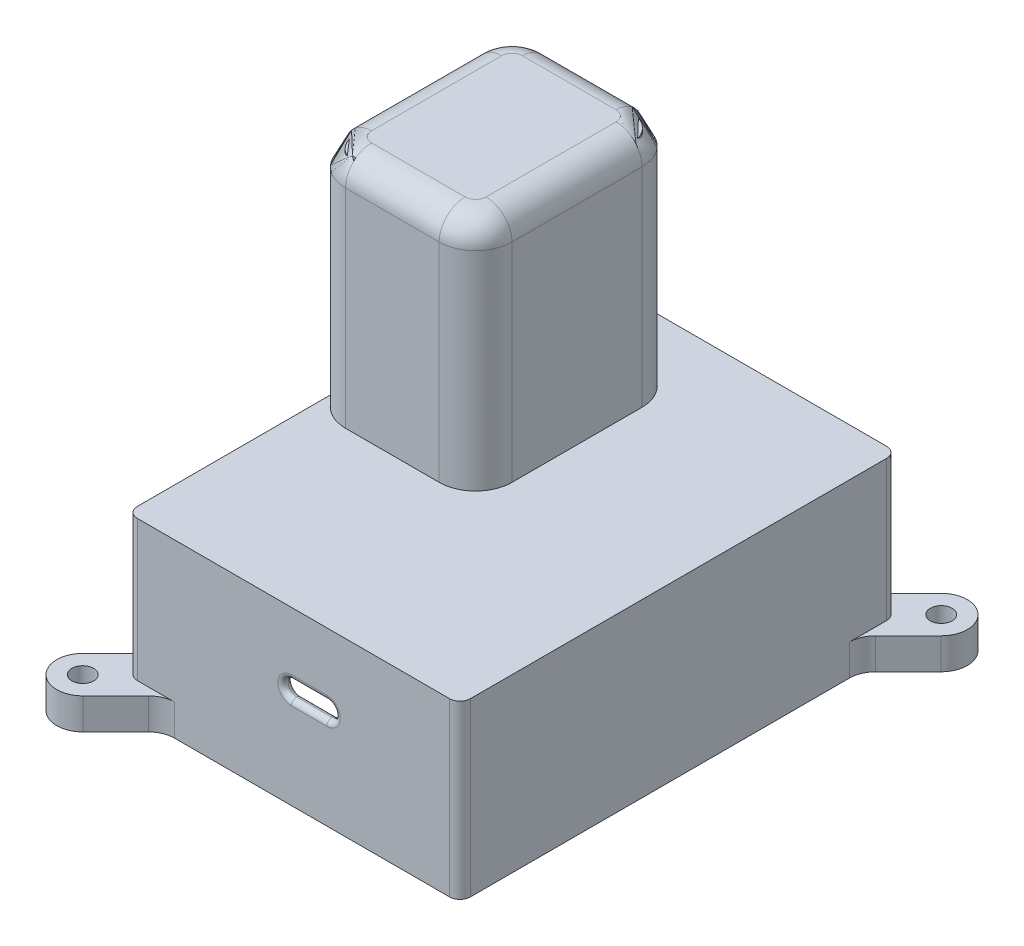
from build123d import *

# Parameters (mm, degrees)
SKETCH1_W                = 64
SKETCH1_H                = 84
SKETCH1_W_2              = 60
SKETCH1_H_2              = 80
BOSS_EXTRUDE1_DEPTH      = 30
SKETCH2_R                = 2.1
BOSS_EXTRUDE2_DEPTH      = 6
CUT_EXTRUDE1_DEPTH       = 30
FILLET2_R                = 1
FILLET7_R                = 2
FILLET8_R                = 1.1
FILLET9_R                = 5
BOSS_EXTRUDE3_START      = 3
SKETCH5_W                = 2
SKETCH5_H                = 35
BOSS_EXTRUDE3_DEPTH      = 3
BOSS_EXTRUDE4_DEPTH      = 45
BOSS_EXTRUDE4_DEPTH_BACK = 3
BOSS_EXTRUDE6_DEPTH      = 2
FILLET11_R               = 5
FILLET12_R               = 2


with BuildPart() as part:
    # Sketch1 → Boss-Extrude1 (new body)
    with BuildSketch(Plane(origin=(0, 0, 0), x_dir=(1, 0, 0), z_dir=(0, 1, 0))):
        with Locations((30, -40)):
            Rectangle(SKETCH1_W, SKETCH1_H)
        with Locations((30, -40)):
            Rectangle(SKETCH1_W_2, SKETCH1_H_2, mode=Mode.SUBTRACT)
    extrude(amount=BOSS_EXTRUDE1_DEPTH)

    # Sketch2 → Boss-Extrude2 (add)
    # profile 1 of 8: a face of its own
    with BuildSketch(Plane(origin=(0, 0, 0), x_dir=(1, 0, 0), z_dir=(0, 1, 0))):
        with BuildLine():
            ThreePointArc((-9.778174593, -82.707106781), (-9.778174593, -89.778174593), (-2.707106781, -89.778174593))
            Line((-2.707106781, -89.778174593), (-2.707106781, -82.707106781))
            Line((-2.707106781, -82.707106781), (-9.778174593, -82.707106781))
        make_face()
        with Locations(Location((-6.242640687, -86.242640687, 0), (0, 0, 270))):
            Circle(SKETCH2_R, mode=Mode.SUBTRACT)
    # profile 2 of 8: a face of its own
    with BuildSketch(Plane(origin=(0, 0, 0), x_dir=(1, 0, 0), z_dir=(0, 1, 0))):
        with BuildLine():
            ThreePointArc((-1.242640687, -86.242640687), (-1.623243025, -88.156057849), (-2.707106781, -89.778174593))
            Line((-2.707106781, -89.778174593), (5.071067812, -82))
            Line((5.071067812, -82), (0, -80))
            Line((0, -80), (-2, -74.928932188))
            Line((-2, -74.928932188), (-9.778174593, -82.707106781))
            ThreePointArc((-9.778174593, -82.707106781), (-6.242640687, -81.242640687), (-2.707106781, -82.707106781))
            ThreePointArc((-2.707106781, -82.707106781), (-1.623243025, -84.329223525), (-1.242640687, -86.242640687))
        make_face()
    # profile 3 of 8: a face of its own
    with BuildSketch(Plane(origin=(0, 0, 0), x_dir=(1, 0, 0), z_dir=(0, 1, 0))):
        with BuildLine():
            Line((-2.707106781, -82.707106781), (-2.707106781, -89.778174593))
            ThreePointArc((-2.707106781, -89.778174593), (-1.623243025, -88.156057849), (-1.242640687, -86.242640687))
            ThreePointArc((-1.242640687, -86.242640687), (-1.623243025, -84.329223525), (-2.707106781, -82.707106781))
        make_face()
    # profile 4 of 8: a face of its own
    with BuildSketch(Plane(origin=(0, 0, 0), x_dir=(1, 0, 0), z_dir=(0, 1, 0))):
        with BuildLine():
            Line((-9.778174593, -82.707106781), (-2.707106781, -82.707106781))
            ThreePointArc((-2.707106781, -82.707106781), (-6.242640687, -81.242640687), (-9.778174593, -82.707106781))
        make_face()
    # profile 5 of 8: a face of its own
    with BuildSketch(Plane(origin=(0, 0, 0), x_dir=(1, 0, 0), z_dir=(0, 1, 0))):
        with BuildLine():
            Line((62, -5.071067812), (69.778174593, 2.707106781))
            ThreePointArc((69.778174593, 2.707106781), (66.242640687, 1.242640687), (62.707106781, 2.707106781))
            ThreePointArc((62.707106781, 2.707106781), (61.243738197, 6.137884352), (62.562095354, 9.626955397))
            Line((62.562095354, 9.626955397), (54.928932188, 2))
            Line((54.928932188, 2), (60, 0))
            Line((60, 0), (62, -5.071067812))
        make_face()
    # profile 6 of 8: a face of its own
    with BuildSketch(Plane(origin=(0, 0, 0), x_dir=(1, 0, 0), z_dir=(0, 1, 0))):
        with BuildLine():
            ThreePointArc((62.707106781, 2.707106781), (66.242640687, 1.242640687), (69.778174593, 2.707106781))
            Line((69.778174593, 2.707106781), (62.707106781, 2.707106781))
        make_face()
    # profile 7 of 8: a face of its own
    with BuildSketch(Plane(origin=(0, 0, 0), x_dir=(1, 0, 0), z_dir=(0, 1, 0))):
        with BuildLine():
            ThreePointArc((62.562095354, 9.626955397), (61.243738197, 6.137884352), (62.707106781, 2.707106781))
            Line((62.707106781, 2.707106781), (62.861321566, 9.925938259))
            Line((62.861321566, 9.925938259), (62.562095354, 9.626955397))
        make_face()
    # profile 8 of 8: a face of its own
    with BuildSketch(Plane(origin=(0, 0, 0), x_dir=(1, 0, 0), z_dir=(0, 1, 0))):
        with BuildLine():
            Line((62.707106781, 2.707106781), (69.778174593, 2.707106781))
            ThreePointArc((69.778174593, 2.707106781), (70.86203835, 4.329223525), (71.242640687, 6.242640687))
            ThreePointArc((71.242640687, 6.242640687), (68.254282354, 10.820117918), (62.861321566, 9.925938259))
            Line((62.861321566, 9.925938259), (62.707106781, 2.707106781))
        make_face()
        with Locations(Location((66.242640687, 6.242640687, 0), (0, 0, 270))):
            Circle(SKETCH2_R, mode=Mode.SUBTRACT)
    extrude(amount=BOSS_EXTRUDE2_DEPTH)

    # Sketch4 → Cut-Extrude1 (cut)
    with BuildSketch(Plane.XY.offset(82)):
        with BuildLine():
            Line((33.001314869, 20.8), (29.601314869, 20.8))
            ThreePointArc((29.601314869, 20.8), (28.001314869, 19.2), (29.601314869, 17.6))
            Line((29.601314869, 17.6), (33.001314869, 17.6))
            Line((33.001314869, 17.6), (36.401314869, 17.6))
            ThreePointArc((36.401314869, 17.6), (38.001314869, 19.2), (36.401314869, 20.8))
            Line((36.401314869, 20.8), (33.001314869, 20.8))
        make_face()
    extrude(amount=-CUT_EXTRUDE1_DEPTH, mode=Mode.SUBTRACT)

    # Fillet2
    fillet2_edges = [part.edges().sort_by_distance(p)[0] for p in [
        (33.001314869, 17.6, 82),
        (38.001314869, 19.2, 82),
        (33.001314869, 20.8, 82),
        (28.001314869, 19.2, 82),
    ]]
    fillet(fillet2_edges, radius=FILLET2_R)

    # Fillet7
    fillet7_edges = [part.edges().sort_by_distance(p)[0] for p in [
        (0, 15, 0),
        (0, 15, 80),
        (60, 15, 80),
        (60, 15, 0),
        (-2, 18, 82),
        (-2, 15, -2),
        (62, 18, -2),
        (62, 15, 82),
    ]]
    fillet(fillet7_edges, radius=FILLET7_R)

    # Fillet8
    # the kernel refuses this fillet: 1.1 mm, written as the material it takes off along each edge
    with BuildSketch(Plane(origin=(36.401314869, 19.2, 80), x_dir=(0, -1, 0), z_dir=(-1, 0, 0))) as fillet8_piece_1:
        with BuildLine():
            CenterArc((2.695445115, 1.1), FILLET8_R, 185.21590857, 84.78409143)
            Line((1.6, 1), (1.6, 0))
            Line((1.6, 0), (2.695445115, 0))
        make_face()
    revolve(axis=Axis((36.401314869, 19.2, 80), (0, 0, 1)), revolution_arc=180, mode=Mode.SUBTRACT)
    with BuildSketch(Plane(origin=(36.401314869, 20.8, 80), x_dir=(0, 1, 0), z_dir=(-1, 0, 0)), Plane(origin=(29.601314869, 17.6, 80), x_dir=(0, -1, 0), z_dir=(1, 0, 0))) as fillet8_piece_2:
        with BuildLine():
            CenterArc((1.095445115, -1.1), FILLET8_R, 90, 84.78409143)
            Line((0, -1), (0, 0))
            Line((0, 0), (1.095445115, 0))
        make_face()
    extrude(amount=6.8, mode=Mode.SUBTRACT)
    with BuildSketch(Plane(origin=(29.601314869, 19.2, 80), x_dir=(0, 1, 0), z_dir=(1, 0, 0))) as fillet8_piece_3:
        with BuildLine():
            CenterArc((2.695445115, 1.1), FILLET8_R, 185.21590857, 84.78409143)
            Line((1.6, 1), (1.6, 0))
            Line((1.6, 0), (2.695445115, 0))
        make_face()
    revolve(axis=Axis((29.601314869, 19.2, 80), (0, 0, 1)), revolution_arc=180, mode=Mode.SUBTRACT)

    # Fillet9
    fillet9_edges = [part.edges().sort_by_distance(p)[0] for p in [
        (-2, 3, 74.928932188),
        (5.071067812, 3, 82),
        (62, 3, 5.071067812),
        (54.928932188, 3, -2),
    ]]
    fillet(fillet9_edges, radius=FILLET9_R)

    # Sketch5 → Boss-Extrude3 (add)
    with BuildSketch(Plane(origin=(0, 30, 0), x_dir=(1, 0, 0), z_dir=(0, 1, 0)).offset(BOSS_EXTRUDE3_START)):
        with Locations((-1, -27.5)):
            Rectangle(SKETCH5_W, SKETCH5_H)
        with BuildLine():
            Line((28, -45), (0, -45))
            Line((0, -45), (0, -78))
            ThreePointArc((0, -78), (0.585786438, -79.414213562), (2, -80))
            Line((2, -80), (58, -80))
            ThreePointArc((58, -80), (59.414213562, -79.414213562), (60, -78))
            Line((60, -78), (60, -2))
            ThreePointArc((60, -2), (59.414213562, -0.585786438), (58, 0))
            Line((58, 0), (2, 0))
            ThreePointArc((2, 0), (0.585786438, -0.585786438), (0, -2))
            Line((0, -2), (0, -10))
            Line((0, -10), (28, -10))
            Line((28, -10), (28, -45))
        make_face()
        with BuildLine():
            Line((0, -45), (-2, -45))
            Line((-2, -45), (-2, -80))
            ThreePointArc((-2, -80), (-1.414213562, -81.414213562), (0, -82))
            Line((0, -82), (60, -82))
            ThreePointArc((60, -82), (61.414213562, -81.414213562), (62, -80))
            Line((62, -80), (62, 0))
            ThreePointArc((62, 0), (61.414213562, 1.414213562), (60, 2))
            Line((60, 2), (0, 2))
            ThreePointArc((0, 2), (-1.414213562, 1.414213562), (-2, 0))
            Line((-2, 0), (-2, -10))
            Line((-2, -10), (0, -10))
            Line((0, -10), (0, -2))
            ThreePointArc((0, -2), (0.585786438, -0.585786438), (2, 0))
            Line((2, 0), (58, 0))
            ThreePointArc((58, 0), (59.414213562, -0.585786438), (60, -2))
            Line((60, -2), (60, -78))
            ThreePointArc((60, -78), (59.414213562, -79.414213562), (58, -80))
            Line((58, -80), (2, -80))
            ThreePointArc((2, -80), (0.585786438, -79.414213562), (0, -78))
            Line((0, -78), (0, -45))
        make_face()
    extrude(amount=-BOSS_EXTRUDE3_DEPTH)

    # Sketch6 → Boss-Extrude4 (add, two sides: drawn at the far end of the back side and taken through both)
    with BuildSketch(Plane(origin=(0, 33, 0), x_dir=(1, 0, 0), z_dir=(0, 1, 0)).offset(-BOSS_EXTRUDE4_DEPTH_BACK)):
        with BuildLine():
            Line((-2, -40), (-2, -15))
            ThreePointArc((-2, -15), (0.050252532, -10.050252532), (5, -8))
            Line((5, -8), (14, -8))
            Line((14, -8), (23, -8))
            ThreePointArc((23, -8), (27.949747468, -10.050252532), (30, -15))
            Line((30, -15), (30, -40))
            ThreePointArc((30, -40), (27.949747468, -44.949747468), (23, -47))
            Line((23, -47), (14, -47))
            Line((14, -47), (5, -47))
            ThreePointArc((5, -47), (0.050252532, -44.949747468), (-2, -40))
        make_face()
        with BuildLine():
            Line((5, -10), (14, -10))
            Line((14, -10), (23, -10))
            ThreePointArc((23, -10), (26.535533906, -11.464466094), (28, -15))
            Line((28, -15), (28, -40))
            ThreePointArc((28, -40), (26.535533906, -43.535533906), (23, -45))
            Line((23, -45), (14, -45))
            Line((14, -45), (5, -45))
            ThreePointArc((5, -45), (1.464466094, -43.535533906), (0, -40))
            Line((0, -40), (0, -15))
            ThreePointArc((0, -15), (1.464466094, -11.464466094), (5, -10))
        make_face(mode=Mode.SUBTRACT)
    extrude(amount=BOSS_EXTRUDE4_DEPTH + BOSS_EXTRUDE4_DEPTH_BACK)

    # Sketch7 → Boss-Extrude6 (add)
    with BuildSketch(Plane(origin=(0, 78, 0), x_dir=(1, 0, 0), z_dir=(0, 1, 0))):
        Polygon((0, -15), (0, -40), (0.050252532, -44.949747468), (4.292893219, -44.949747468), (5, -45), (23, -45), (25.012302519, -45), (26.626096331, -43.896174296), (28, -42.956432073), (28, -40), (28, -15), (27.949747468, -10.050252532), (23, -10), (5, -10), (3.904127918, -9.641868727), (2.415865255, -9.84051764), (1.161892949, -10.698227499), (0.397822666, -11.748824139), (-0.232535318, -13.257862949), align=None)
    extrude(amount=-BOSS_EXTRUDE6_DEPTH)

    # Fillet11
    # the kernel refuses this fillet: 5 mm, written as the material it takes off along each edge
    with BuildSketch(Plane(origin=(5, 78, 40), x_dir=(-0.7071067811865479, 0, 0.7071067811865472), z_dir=(0.7071067811865472, 0, 0.7071067811865479))) as fillet11_piece_1:
        with BuildLine():
            CenterArc((7 - FILLET11_R, FILLET11_R), FILLET11_R, 270, 90)
            Line((7 - FILLET11_R, 0), (7, 0))
            Line((7, 0), (7, FILLET11_R))
        make_face()
    revolve(axis=Axis((5, 78, 40), (0, -1, 0)), revolution_arc=45, mode=Mode.SUBTRACT)
    with BuildSketch(Plane(origin=(23, 78, 47), x_dir=(0, -1, 0), z_dir=(-1, 0, 0)), Plane(origin=(5, 78, 8), x_dir=(0, -1, 0), z_dir=(1, 0, 0))) as fillet11_piece_2:
        with BuildLine():
            CenterArc((FILLET11_R, -FILLET11_R), FILLET11_R, 90, 90)
            Line((0, -FILLET11_R), (0, 0))
            Line((0, 0), (FILLET11_R, 0))
        make_face()
    extrude(amount=18, mode=Mode.SUBTRACT)
    with BuildSketch(Plane(origin=(23, 78, 40), x_dir=(1, 0, 0), z_dir=(0, 0, -1))) as fillet11_piece_3:
        with BuildLine():
            CenterArc((7 - FILLET11_R, FILLET11_R), FILLET11_R, 270, 90)
            Line((7 - FILLET11_R, 0), (7, 0))
            Line((7, 0), (7, FILLET11_R))
        make_face()
    revolve(axis=Axis((23, 78, 40), (0, -1, 0)), revolution_arc=90, mode=Mode.SUBTRACT)
    with BuildSketch(Plane(origin=(30, 78, 15), x_dir=(0, -1, 0), z_dir=(0, 0, 1)), Plane(origin=(-2, 78, 40), x_dir=(0, -1, 0), z_dir=(0, 0, -1))) as fillet11_piece_4:
        with BuildLine():
            CenterArc((FILLET11_R, -FILLET11_R), FILLET11_R, 90, 90)
            Line((0, -FILLET11_R), (0, 0))
            Line((0, 0), (FILLET11_R, 0))
        make_face()
    extrude(amount=25, mode=Mode.SUBTRACT)
    with BuildSketch(Plane(origin=(23, 78, 15), x_dir=(0, 0, -1), z_dir=(-1, 0, 0))) as fillet11_piece_5:
        with BuildLine():
            CenterArc((7 - FILLET11_R, FILLET11_R), FILLET11_R, 270, 90)
            Line((7 - FILLET11_R, 0), (7, 0))
            Line((7, 0), (7, FILLET11_R))
        make_face()
    revolve(axis=Axis((23, 78, 15), (0, -1, 0)), revolution_arc=45, mode=Mode.SUBTRACT)
    with BuildSketch(Plane(origin=(5, 78, 15), x_dir=(-1, 0, 0), z_dir=(0, 0, 1))) as fillet11_piece_6:
        with BuildLine():
            CenterArc((7 - FILLET11_R, FILLET11_R), FILLET11_R, 270, 90)
            Line((7 - FILLET11_R, 0), (7, 0))
            Line((7, 0), (7, FILLET11_R))
        make_face()
    revolve(axis=Axis((5, 78, 15), (0, -1, 0)), revolution_arc=90, mode=Mode.SUBTRACT)
    with BuildSketch(Plane(origin=(23, 78, 15), x_dir=(0.7071067811865481, 0, -0.7071067811865471), z_dir=(-0.7071067811865471, 0, -0.7071067811865481))) as fillet11_piece_7:
        with BuildLine():
            CenterArc((7 - FILLET11_R, FILLET11_R), FILLET11_R, 270, 90)
            Line((7 - FILLET11_R, 0), (7, 0))
            Line((7, 0), (7, FILLET11_R))
        make_face()
    revolve(axis=Axis((23, 78, 15), (0, -1, 0)), revolution_arc=45, mode=Mode.SUBTRACT)
    with BuildSketch(Plane(origin=(5, 78, 40), x_dir=(0, 0, 1), z_dir=(1, 0, 0))) as fillet11_piece_8:
        with BuildLine():
            CenterArc((7 - FILLET11_R, FILLET11_R), FILLET11_R, 270, 90)
            Line((7 - FILLET11_R, 0), (7, 0))
            Line((7, 0), (7, FILLET11_R))
        make_face()
    revolve(axis=Axis((5, 78, 40), (0, -1, 0)), revolution_arc=45, mode=Mode.SUBTRACT)

    # Fillet12
    # the kernel refuses this fillet: 2 mm, written as the material it adds along each edge
    with BuildSketch(Plane(origin=(0, 30, 15), x_dir=(0, -1, 0), z_dir=(0, 0, -1))) as fillet12_piece_1_section:
        with BuildLine():
            CenterArc((FILLET12_R, -FILLET12_R), FILLET12_R, 90, 90)
            Line((0, -FILLET12_R), (0, 0))
            Line((0, 0), (FILLET12_R, 0))
        make_face()
    fillet12_piece_1 = extrude(amount=13, mode=Mode.PRIVATE)
    fillet12_piece_1 = split(fillet12_piece_1, bisect_by=Plane(origin=(0, 30, 10), z_dir=(0, 0, 1)), keep=Keep.TOP, mode=Mode.PRIVATE)
    fillet12_piece_1 = fillet12_piece_1 & Plane(origin=(5, 30, 15), x_dir=(-1, 0, 0), z_dir=(0, -1, 0)) * Cylinder(7, 35, mode=Mode.PRIVATE)
    fillet12_piece_1 = fillet12_piece_1 - Plane(origin=(5, 30, 15), x_dir=(-1, 0, 0), z_dir=(0, -1, 0)) * Cylinder(5, 35, mode=Mode.PRIVATE)
    add(fillet12_piece_1)
    with BuildSketch(Plane(origin=(0, 30, 10), x_dir=(0, -1, 0), z_dir=(0, 0, -1))) as fillet12_piece_2_section:
        with BuildLine():
            CenterArc((FILLET12_R, -FILLET12_R), FILLET12_R, 90, 90)
            Line((0, -FILLET12_R), (0, 0))
            Line((0, 0), (FILLET12_R, 0))
        make_face()
    fillet12_piece_2 = extrude(amount=8, mode=Mode.PRIVATE)
    fillet12_piece_2 = fillet12_piece_2 & Plane(origin=(5, 30, 15), x_dir=(-1, 0, 0), z_dir=(0, -1, 0)) * Cylinder(7, 25, mode=Mode.PRIVATE)
    add(fillet12_piece_2)
    with BuildSketch(Plane(origin=(0, 30, 10), x_dir=(0, -1, 0), z_dir=(0, 0, -1))) as fillet12_piece_3_section:
        with BuildLine():
            CenterArc((FILLET12_R, -FILLET12_R), FILLET12_R, 90, 90)
            Line((0, -FILLET12_R), (0, 0))
            Line((0, 0), (FILLET12_R, 0))
        make_face()
    fillet12_piece_3 = extrude(amount=8, mode=Mode.PRIVATE)
    fillet12_piece_3 = fillet12_piece_3 - Plane(origin=(5, 30, 15), x_dir=(-1, 0, 0), z_dir=(0, -1, 0)) * Cylinder(7, 25, mode=Mode.PRIVATE)
    add(fillet12_piece_3)
    with BuildSketch(Plane(origin=(2, 30, 2), x_dir=(0, 0, -1), z_dir=(1, 0, 0))) as fillet12_piece_4:
        with BuildLine():
            CenterArc((2 - FILLET12_R, -FILLET12_R), FILLET12_R, 0, 90)
            Line((2 - FILLET12_R, 0), (2, 0))
            Line((2, 0), (2, -FILLET12_R))
        make_face()
    revolve(axis=Axis((2, 30, 2), (0, 1, 0)), revolution_arc=90)
    with BuildSketch(Plane(origin=(2, 30, 0), x_dir=(0, -1, 0), z_dir=(1, 0, 0)), Plane(origin=(58, 30, 80), x_dir=(0, -1, 0), z_dir=(-1, 0, 0))) as fillet12_piece_5:
        with BuildLine():
            CenterArc((FILLET12_R, -FILLET12_R), FILLET12_R, 90, 90)
            Line((0, -FILLET12_R), (0, 0))
            Line((0, 0), (FILLET12_R, 0))
        make_face()
    extrude(amount=56)
    with BuildSketch(Plane(origin=(58, 30, 2), x_dir=(1, 0, 0), z_dir=(0, 0, 1))) as fillet12_piece_6:
        with BuildLine():
            CenterArc((2 - FILLET12_R, -FILLET12_R), FILLET12_R, 0, 90)
            Line((2 - FILLET12_R, 0), (2, 0))
            Line((2, 0), (2, -FILLET12_R))
        make_face()
    revolve(axis=Axis((58, 30, 2), (0, 1, 0)), revolution_arc=90)
    with BuildSketch(Plane(origin=(60, 30, 2), x_dir=(0, -1, 0), z_dir=(0, 0, 1))) as fillet12_piece_7:
        with BuildLine():
            CenterArc((FILLET12_R, -FILLET12_R), FILLET12_R, 90, 90)
            Line((0, -FILLET12_R), (0, 0))
            Line((0, 0), (FILLET12_R, 0))
        make_face()
    extrude(amount=76)
    with BuildSketch(Plane(origin=(58, 30, 78), x_dir=(1, 0, 0), z_dir=(0, 0, -1))) as fillet12_piece_8:
        with BuildLine():
            CenterArc((2 - FILLET12_R, FILLET12_R), FILLET12_R, 270, 90)
            Line((2 - FILLET12_R, 0), (2, 0))
            Line((2, 0), (2, FILLET12_R))
        make_face()
    revolve(axis=Axis((58, 30, 78), (0, -1, 0)), revolution_arc=90)
    with BuildSketch(Plane(origin=(2, 30, 78), x_dir=(-1, 0, 0), z_dir=(0, 0, -1))) as fillet12_piece_9:
        with BuildLine():
            CenterArc((2 - FILLET12_R, -FILLET12_R), FILLET12_R, 0, 90)
            Line((2 - FILLET12_R, 0), (2, 0))
            Line((2, 0), (2, -FILLET12_R))
        make_face()
    revolve(axis=Axis((2, 30, 78), (0, 1, 0)), revolution_arc=90)
    with BuildSketch(Plane(origin=(0, 30, 78), x_dir=(0, -1, 0), z_dir=(0, 0, -1))) as fillet12_piece_10_section:
        with BuildLine():
            CenterArc((FILLET12_R, -FILLET12_R), FILLET12_R, 90, 90)
            Line((0, -FILLET12_R), (0, 0))
            Line((0, 0), (FILLET12_R, 0))
        make_face()
    fillet12_piece_10 = extrude(amount=33, mode=Mode.PRIVATE)
    fillet12_piece_10 = fillet12_piece_10 - Plane(origin=(5, 30, 40), x_dir=(0, 0, 1), z_dir=(0, -1, 0)) * Cylinder(7, 74, mode=Mode.PRIVATE)
    add(fillet12_piece_10)
    with BuildSketch(Plane(origin=(0, 30, 78), x_dir=(0, -1, 0), z_dir=(0, 0, -1))) as fillet12_piece_11_section:
        with BuildLine():
            CenterArc((FILLET12_R, -FILLET12_R), FILLET12_R, 90, 90)
            Line((0, -FILLET12_R), (0, 0))
            Line((0, 0), (FILLET12_R, 0))
        make_face()
    fillet12_piece_11 = extrude(amount=33, mode=Mode.PRIVATE)
    fillet12_piece_11 = fillet12_piece_11 & Plane(origin=(5, 30, 40), x_dir=(0, 0, 1), z_dir=(0, -1, 0)) * Cylinder(7, 74, mode=Mode.PRIVATE)
    add(fillet12_piece_11)
    with BuildSketch(Plane(origin=(0, 30, 78), x_dir=(0, -1, 0), z_dir=(0, 0, -1))) as fillet12_piece_12_section:
        with BuildLine():
            CenterArc((FILLET12_R, -FILLET12_R), FILLET12_R, 90, 90)
            Line((0, -FILLET12_R), (0, 0))
            Line((0, 0), (FILLET12_R, 0))
        make_face()
    fillet12_piece_12 = extrude(amount=38, mode=Mode.PRIVATE)
    fillet12_piece_12 = split(fillet12_piece_12, bisect_by=Plane(origin=(0, 30, 45), z_dir=(0, 0, -1)), keep=Keep.TOP, mode=Mode.PRIVATE)
    fillet12_piece_12 = fillet12_piece_12 & Plane(origin=(5, 30, 40), x_dir=(0, 0, 1), z_dir=(0, -1, 0)) * Cylinder(7, 84, mode=Mode.PRIVATE)
    fillet12_piece_12 = fillet12_piece_12 - Plane(origin=(5, 30, 40), x_dir=(0, 0, 1), z_dir=(0, -1, 0)) * Cylinder(5, 84, mode=Mode.PRIVATE)
    add(fillet12_piece_12)


solid = part.part
